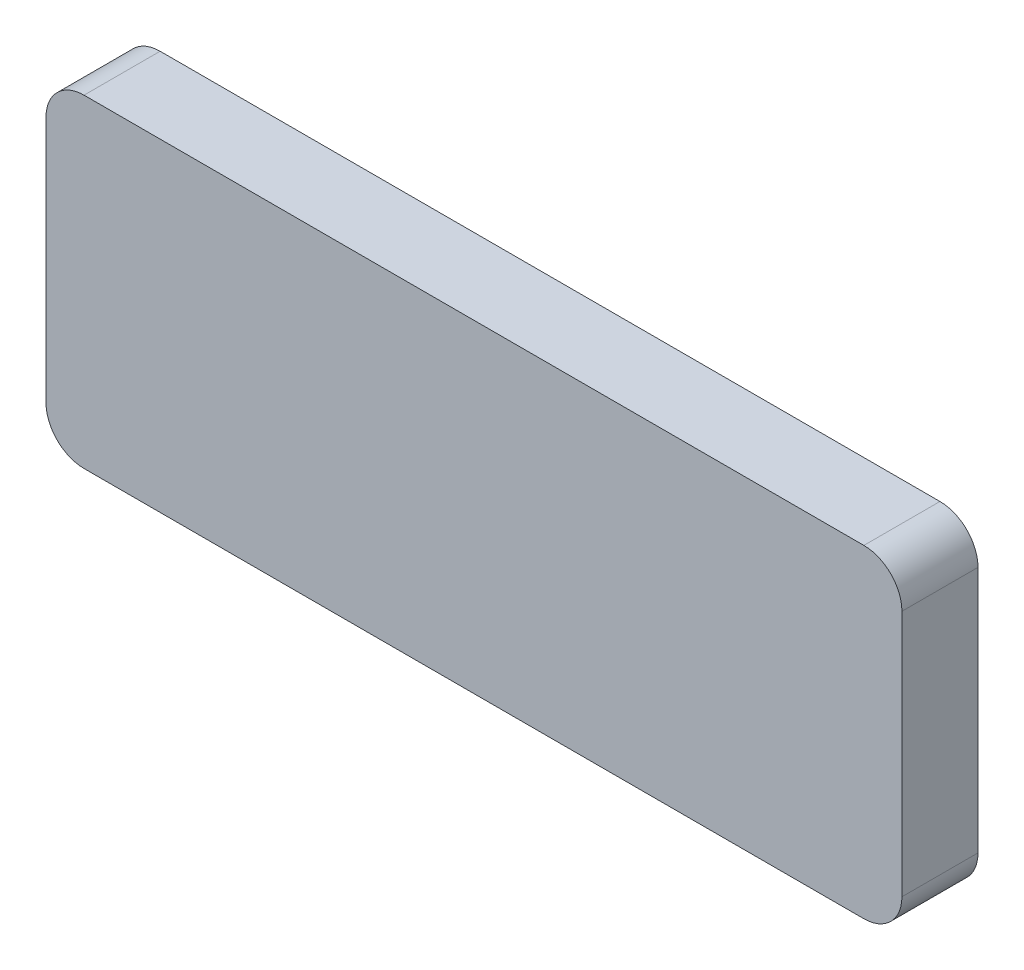
from build123d import *

# Parameters (mm, degrees)
BOSS_EXTRUDE1_DEPTH = 12.7


with BuildPart() as part:
    # Sketch1 → Boss-Extrude1 (new body)
    with BuildSketch(Plane.XY):
        with BuildLine():
            Line((71.4375, -20.6375), (71.4375, 20.6375))
            ThreePointArc((71.4375, 20.6375), (69.577628061, 25.127628061), (65.0875, 26.9875))
            Line((65.0875, 26.9875), (-65.0875, 26.9875))
            ThreePointArc((-65.0875, 26.9875), (-69.577628061, 25.127628061), (-71.4375, 20.6375))
            Line((-71.4375, 20.6375), (-71.4375, -20.6375))
            ThreePointArc((-71.4375, -20.6375), (-69.577628061, -25.127628061), (-65.0875, -26.9875))
            Line((-65.0875, -26.9875), (65.0875, -26.9875))
            ThreePointArc((65.0875, -26.9875), (69.577628061, -25.127628061), (71.4375, -20.6375))
        make_face()
    extrude(amount=-BOSS_EXTRUDE1_DEPTH)


solid = part.part
